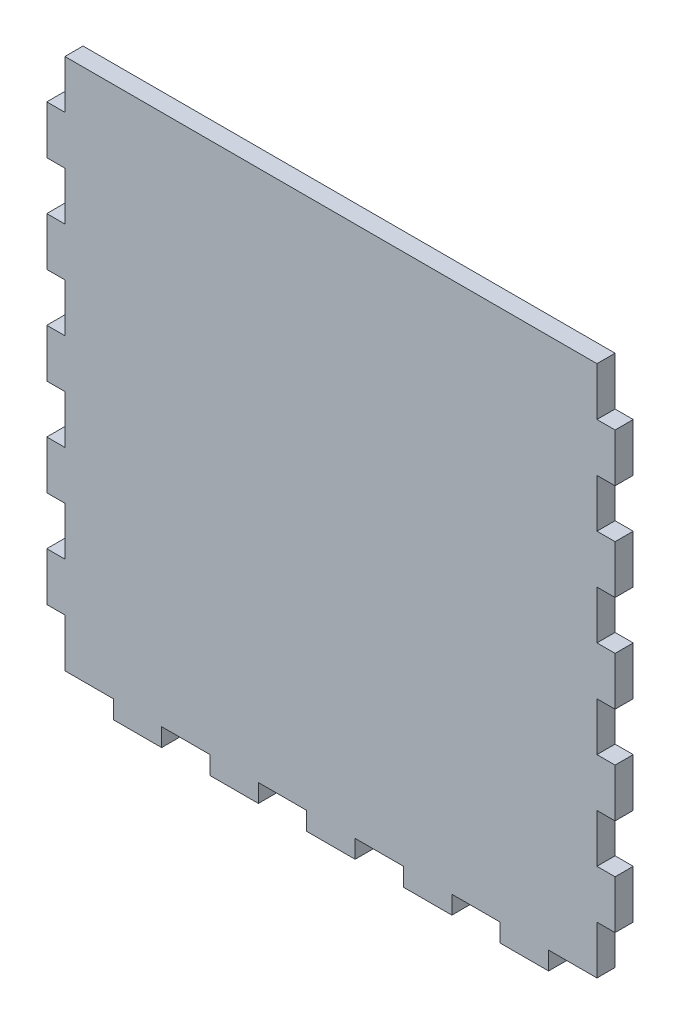
from build123d import *

# Parameters (mm, degrees)
SKETCH2_W               = 279.4
SKETCH2_H               = 279.4
BOSS_EXTRUDE1_DEPTH     = 9.525
SKETCH4_W               = 9.525
SKETCH4_H               = 25.4
BOSS_EXTRUDE3_DEPTH     = 9.525
LPATTERN2_COUNT         = 5
LPATTERN2_PITCH         = 50.8
MIRROR2_COPY_1_SKETCH_W = 9.525
MIRROR2_COPY_1_SKETCH_H = 25.4
MIRROR2_COPY_1_DEPTH    = 9.525
MIRROR2_COPY_2_SKETCH_W = 9.525
MIRROR2_COPY_2_SKETCH_H = 25.4
MIRROR2_COPY_2_DEPTH    = 9.525
MIRROR2_COPY_3_SKETCH_W = 9.525
MIRROR2_COPY_3_SKETCH_H = 25.4
MIRROR2_COPY_3_DEPTH    = 9.525
MIRROR2_COPY_4_SKETCH_W = 9.525
MIRROR2_COPY_4_SKETCH_H = 25.4
MIRROR2_COPY_4_DEPTH    = 9.525
MIRROR2_COPY_5_SKETCH_W = 9.525
MIRROR2_COPY_5_SKETCH_H = 25.4
MIRROR2_COPY_5_DEPTH    = 9.525
SKETCH5_W               = 25.4
SKETCH5_H               = 9.525
BOSS_EXTRUDE4_DEPTH     = 9.525
LPATTERN3_COUNT         = 5
LPATTERN3_PITCH         = 50.8


with BuildPart() as part:
    # Sketch2 → Boss-Extrude1 (new body)
    with BuildSketch(Plane.XY):
        Rectangle(SKETCH2_W, SKETCH2_H)
    extrude(amount=BOSS_EXTRUDE1_DEPTH)

    # Sketch4 → Boss-Extrude3 (add)
    with BuildSketch(Plane(origin=(139.7, 0, 0), x_dir=(0, 0, -1), z_dir=(1, 0, 0))):
        with Locations((-4.7625, -101.6)):
            Rectangle(SKETCH4_W, SKETCH4_H)
    boss_extrude3 = extrude(amount=BOSS_EXTRUDE3_DEPTH)

    # LPattern2: Boss-Extrude3 ×5
    with Locations(*[(0, i * LPATTERN2_PITCH, 0) for i in range(1, LPATTERN2_COUNT)]):
        add(boss_extrude3)

    # Mirror2 copy 1 sketch → Mirror2 copy 1 (add)
    with BuildSketch(Plane(origin=(-139.7, 50.8, 0), x_dir=(0, 0, -1), z_dir=(-1, 0, 0))):
        with Locations((-4.7625, 101.6)):
            Rectangle(MIRROR2_COPY_1_SKETCH_W, MIRROR2_COPY_1_SKETCH_H)
    extrude(amount=MIRROR2_COPY_1_DEPTH)

    # Mirror2 copy 2 sketch → Mirror2 copy 2 (add)
    with BuildSketch(Plane(origin=(-139.7, 101.6, 0), x_dir=(0, 0, -1), z_dir=(-1, 0, 0))):
        with Locations((-4.7625, 101.6)):
            Rectangle(MIRROR2_COPY_2_SKETCH_W, MIRROR2_COPY_2_SKETCH_H)
    extrude(amount=MIRROR2_COPY_2_DEPTH)

    # Mirror2 copy 3 sketch → Mirror2 copy 3 (add)
    with BuildSketch(Plane(origin=(-139.7, 152.4, 0), x_dir=(0, 0, -1), z_dir=(-1, 0, 0))):
        with Locations((-4.7625, 101.6)):
            Rectangle(MIRROR2_COPY_3_SKETCH_W, MIRROR2_COPY_3_SKETCH_H)
    extrude(amount=MIRROR2_COPY_3_DEPTH)

    # Mirror2 copy 4 sketch → Mirror2 copy 4 (add)
    with BuildSketch(Plane(origin=(-139.7, 203.2, 0), x_dir=(0, 0, -1), z_dir=(-1, 0, 0))):
        with Locations((-4.7625, 101.6)):
            Rectangle(MIRROR2_COPY_4_SKETCH_W, MIRROR2_COPY_4_SKETCH_H)
    extrude(amount=MIRROR2_COPY_4_DEPTH)

    # Mirror2 copy 5 sketch → Mirror2 copy 5 (add)
    with BuildSketch(Plane(origin=(-139.7, 0, 0), x_dir=(0, 0, -1), z_dir=(-1, 0, 0))):
        with Locations((-4.7625, 101.6)):
            Rectangle(MIRROR2_COPY_5_SKETCH_W, MIRROR2_COPY_5_SKETCH_H)
    extrude(amount=MIRROR2_COPY_5_DEPTH)

    # Sketch5 → Boss-Extrude4 (add)
    with BuildSketch(Plane.XZ.offset(139.7)):
        with Locations((-101.6, 4.7625)):
            Rectangle(SKETCH5_W, SKETCH5_H)
    boss_extrude4 = extrude(amount=BOSS_EXTRUDE4_DEPTH)

    # LPattern3: Boss-Extrude4 ×5
    with Locations(*[(i * LPATTERN3_PITCH, 0, 0) for i in range(1, LPATTERN3_COUNT)]):
        add(boss_extrude4)


solid = part.part
